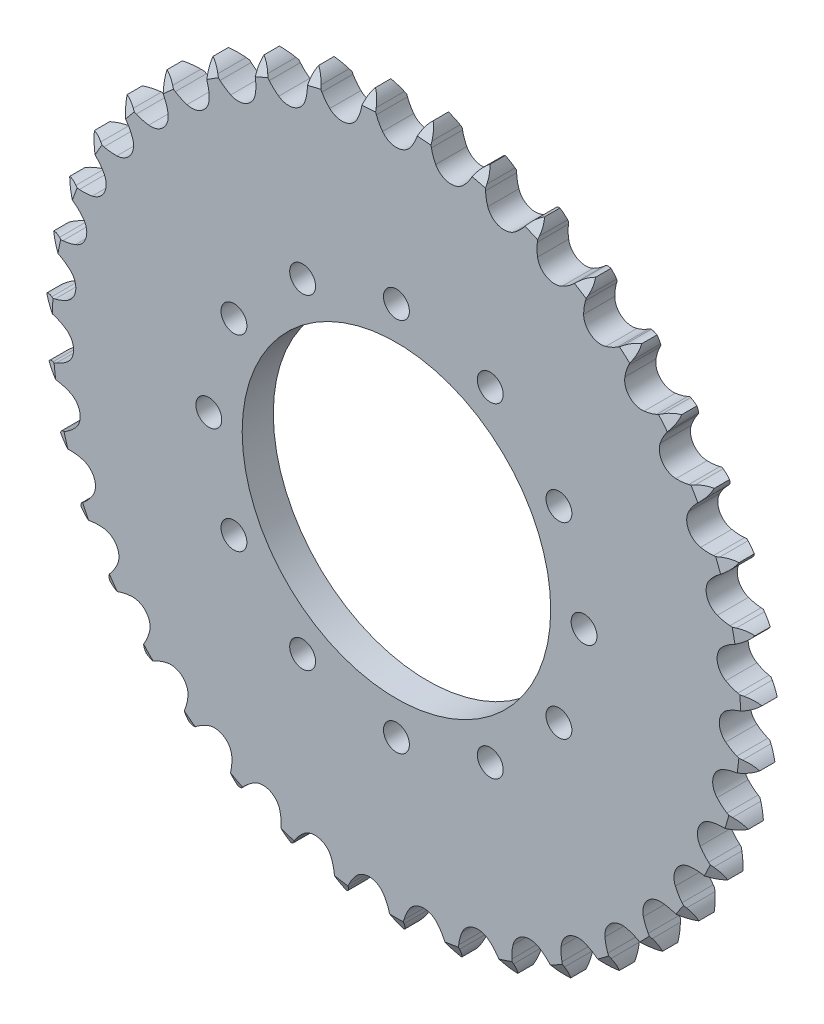
from build123d import *

# Parameters (mm, degrees)
EXTRUSION_DEPTH        = 7.2136
CUT_EXTRUDE_DEPTH      = 118.514389318
CUT_EXTRUDE_DEPTH_BACK = 118.514389318
SKETCH1_R              = 35.764294032
F_6_0MM_DOWEL_HOLE1_D  = 6
CIRPATTERN1_COUNT      = 12


with BuildPart() as part:
    # Teeth Sketch → Extrusion (new body)
    with BuildSketch(Plane.XY):
        with BuildLine():
            ThreePointArc((6.676484762, 82.703103732), (5.710873677, 81.555589606), (5.037571935, 80.215493266))
            Line((5.037571935, 80.215493266), (4.65053543, 79.150636707))
            ThreePointArc((4.65053543, 79.150636707), (4.030589042, 77.787636082), (3.22092759, 76.5280518))
            ThreePointArc((3.22092759, 76.5280518), (0, 74.905926143), (-3.22092759, 76.5280518))
            ThreePointArc((-3.22092759, 76.5280518), (-4.030589042, 77.787636082), (-4.65053543, 79.150636707))
            Line((-4.65053543, 79.150636707), (-5.037571935, 80.215493266))
            ThreePointArc((-5.037571935, 80.215493266), (-5.710873677, 81.555589606), (-6.676484762, 82.703103732))
            ThreePointArc((-6.676484762, 82.703103732), (-7.445517227, 81.415554702), (-7.895133318, 79.984807062))
            Line((-7.895133318, 79.984807062), (-8.106342797, 78.871655094))
            ThreePointArc((-8.106342797, 78.871655094), (-8.499620367, 77.426858575), (-9.096745387, 76.053706749))
            ThreePointArc((-9.096745387, 76.053706749), (-12.015755556, 73.935914073), (-15.455180235, 75.020360508))
            ThreePointArc((-15.455180235, 75.020360508), (-16.456408311, 76.133754674), (-17.286967233, 77.379658404))
            Line((-17.286967233, 77.379658404), (-17.83980672, 78.368640329))
            ThreePointArc((-17.83980672, 78.368640329), (-18.719355953, 79.583377579), (-19.856536839, 80.561136787))
            ThreePointArc((-19.856536839, 80.561136787), (-20.409073146, 79.166899696), (-20.623358765, 77.682556369))
            Line((-20.623358765, 77.682556369), (-20.653271004, 76.549939044))
            ThreePointArc((-20.653271004, 76.549939044), (-20.809694072, 75.060766102), (-21.178817437, 73.609610642))
            ThreePointArc((-21.178817437, 73.609610642), (-23.720309356, 71.051000665), (-27.289151829, 71.569681286))
            ThreePointArc((-27.289151829, 71.569681286), (-28.456015249, 72.508049011), (-29.475675664, 73.604587595))
            Line((-29.475675664, 73.604587595), (-30.179999883, 74.492080773))
            ThreePointArc((-30.179999883, 74.492080773), (-31.243016742, 75.549997876), (-32.522315041, 76.332678717))
            ThreePointArc((-32.522315041, 76.332678717), (-32.844044791, 74.867863573), (-32.817450053, 73.368368272))
            Line((-32.817450053, 73.368368272), (-32.66529034, 72.245619783))
            ThreePointArc((-32.66529034, 72.245619783), (-32.580807632, 70.750639215), (-32.71236924, 69.259064285))
            ThreePointArc((-32.71236924, 69.259064285), (-34.810519602, 66.325903661), (-38.416348726, 66.265384911))
            ThreePointArc((-38.416348726, 66.265384911), (-39.71862634, 67.004422965), (-40.900979579, 67.923196629))
            Line((-40.900979579, 67.923196629), (-41.738546902, 68.686215454))
            ThreePointArc((-41.738546902, 68.686215454), (-42.957499809, 69.559912912), (-44.345782367, 70.127244363))
            ThreePointArc((-44.345782367, 70.127244363), (-44.428372928, 68.629789109), (-44.161586623, 67.153977974))
            Line((-44.161586623, 67.153977974), (-43.831295815, 66.070176918))
            ThreePointArc((-43.831295815, 66.070176918), (-43.508095388, 64.608107935), (-43.398687863, 63.114744543))
            ThreePointArc((-43.398687863, 63.114744543), (-44.999155676, 59.883000591), (-48.54858237, 59.244849876))
            ThreePointArc((-48.54858237, 59.244849876), (-49.952545871, 59.765417561), (-51.266969607, 60.48263055))
            Line((-51.266969607, 60.48263055), (-52.21608748, 61.101413234))
            ThreePointArc((-52.21608748, 61.101413234), (-53.559406195, 61.768262742), (-55.020717224, 62.105551216))
            ThreePointArc((-55.020717224, 62.105551216), (-54.862029543, 60.614239157), (-54.361961296, 59.200334922))
            Line((-54.361961296, 59.200334922), (-53.862093752, 58.183551176))
            ThreePointArc((-53.862093752, 58.183551176), (-53.308546327, 56.792260597), (-52.961003266, 55.335786069))
            ThreePointArc((-52.961003266, 55.335786069), (-54.022337255, 51.889159262), (-57.423433231, 50.689904348))
            ThreePointArc((-57.423433231, 50.689904348), (-58.892720703, 50.978519235), (-60.305172051, 51.475596109))
            Line((-60.305172051, 51.475596109), (-61.34125882, 51.934116506))
            ThreePointArc((-61.34125882, 51.934116506), (-62.774152094, 52.376847013), (-64.270644405, 52.475356916))
            ThreePointArc((-64.270644405, 52.475356916), (-63.87478841, 51.02881225), (-63.154389727, 49.713434291))
            Line((-63.154389727, 49.713434291), (-62.497891753, 48.790002021))
            ThreePointArc((-62.497891753, 48.790002021), (-61.728333918, 47.505523541), (-61.151656504, 46.123659804))
            ThreePointArc((-61.151656504, 46.123659804), (-61.646368676, 42.551415963), (-64.811047336, 40.822116924))
            ThreePointArc((-64.811047336, 40.822116924), (-66.307605004, 40.871304038), (-67.781502216, 41.135370767))
            Line((-67.781502216, 41.135370767), (-68.877723777, 41.42175344))
            ThreePointArc((-68.877723777, 41.42175344), (-70.363080428, 41.628898458), (-71.855995657, 41.486078435))
            ThreePointArc((-71.855995657, 41.486078435), (-71.23322381, 40.12176591), (-70.311152637, 38.938981826))
            Line((-70.311152637, 38.938981826), (-69.515027187, 38.132817442))
            ThreePointArc((-69.515027187, 38.132817442), (-68.549390085, 36.988418379), (-67.75851396, 35.716954977))
            ThreePointArc((-67.75851396, 35.716954977), (-67.673791529, 32.111613343), (-70.520089358, 29.897058114))
            ThreePointArc((-70.520089358, 29.897058114), (-72.005157166, 29.705543536), (-73.502327078, 29.729760931))
            Line((-73.502327078, 29.729760931), (-74.630291869, 29.836588719))
            ThreePointArc((-74.630291869, 29.836588719), (-76.129641939, 29.8027833), (-77.580314364, 29.422332315))
            ThreePointArc((-77.580314364, 29.422332315), (-76.74675613, 28.175586908), (-75.646893627, 27.156030185))
            Line((-75.646893627, 27.156030185), (-74.731759931, 26.488012922))
            ThreePointArc((-74.731759931, 26.488012922), (-73.595053056, 25.51333261), (-72.610461496, 24.385199777))
            ThreePointArc((-72.610461496, 24.385199777), (-71.948498729, 20.840136804), (-74.402698108, 18.197681204))
            ThreePointArc((-74.402698108, 18.197681204), (-75.837813579, 17.77042506), (-77.319480277, 17.554165902))
            Line((-77.319480277, 17.554165902), (-78.449974603, 17.478672021))
            ThreePointArc((-78.449974603, 17.478672021), (-79.924485713, 17.204791709), (-81.295343681, 16.596563242))
            ThreePointArc((-81.295343681, 16.596563242), (-80.27258778, 15.499675005), (-79.023419807, 14.669751627))
            Line((-79.023419807, 14.669751627), (-78.012979347, 14.15718278))
            ThreePointArc((-78.012979347, 14.15718278), (-76.734642811, 13.377464928), (-75.58183622, 12.421880712))
            ThreePointArc((-75.58183622, 12.421880712), (-74.359777605, 9.028911669), (-76.358316059, 6.026993909))
            ThreePointArc((-76.358316059, 6.026993909), (-77.706310456, 5.375061909), (-79.134099551, 4.923927198))
            Line((-79.134099551, 4.923927198), (-80.237844202, 4.6680669))
            ThreePointArc((-80.237844202, 4.6680669), (-81.649327289, 4.161205049), (-82.904866299, 3.340951899))
            ThreePointArc((-82.904866299, 3.340951899), (-81.719401571, 2.422329661), (-80.353280924, 1.803534207))
            Line((-80.353280924, 1.803534207), (-79.273703577, 1.45968904))
            ThreePointArc((-79.273703577, 1.45968904), (-77.886845624, 0.895127931), (-76.595681088, 0.136841462))
            ThreePointArc((-76.595681088, 0.136841462), (-74.8451773, -3.016157536), (-76.336293733, -6.299789363))
            ThreePointArc((-76.336293733, -6.299789363), (-77.56225471, -7.159512522), (-78.899187214, -7.833838635))
            Line((-78.899187214, -7.833838635), (-79.947595784, -8.263438702))
            ThreePointArc((-79.947595784, -8.263438702), (-81.259494176, -8.990154635), (-82.367196428, -10.001188343))
            ThreePointArc((-82.367196428, -10.001188343), (-81.049725787, -10.717752749), (-79.602034272, -11.109393802))
            Line((-79.602034272, -11.109393802), (-78.481280524, -11.275609878))
            ThreePointArc((-78.481280524, -11.275609878), (-77.021820047, -11.610392409), (-75.625738049, -12.151741911))
            ThreePointArc((-75.625738049, -12.151741911), (-73.392126218, -14.983109845), (-74.337201497, -18.463411399))
            ThreePointArc((-74.337201497, -18.463411399), (-75.409377308, -19.50865934), (-76.620827372, -20.388712162))
            Line((-76.620827372, -20.388712162), (-77.586746629, -20.980925582))
            ThreePointArc((-77.586746629, -20.980925582), (-78.765082849, -21.908674036), (-79.696259435, -23.08430306))
            ThreePointArc((-79.696259435, -23.08430306), (-78.280904679, -23.580250992), (-76.789136745, -23.734594346))
            Line((-76.789136745, -23.734594346), (-75.656233531, -23.718876424))
            ThreePointArc((-75.656233531, -23.718876424), (-74.161969788, -23.815209685), (-72.697128119, -24.125601551))
            ThreePointArc((-72.697128119, -24.125601551), (-70.038257617, -26.562007479), (-70.41281479, -30.148840778))
            ThreePointArc((-70.41281479, -30.148840778), (-71.303436645, -31.352542128), (-72.358028349, -32.415528753))
            Line((-72.358028349, -32.415528753), (-73.216441492, -33.155017511))
            ThreePointArc((-73.216441492, -33.155017511), (-74.230697248, -34.259770288), (-74.961231185, -35.569546454))
            ThreePointArc((-74.961231185, -35.569546454), (-73.484649258, -35.832033121), (-71.987440912, -35.745081364))
            Line((-71.987440912, -35.745081364), (-70.871729829, -35.547836529))
            ThreePointArc((-70.871729829, -35.547836529), (-69.381363468, -35.403225539), (-67.885700756, -35.474620783))
            ThreePointArc((-67.885700756, -35.474620783), (-64.870434934, -37.452963072), (-64.664773166, -41.053431017))
            ThreePointArc((-64.664773166, -41.053431017), (-65.350774426, -42.384410543), (-66.221194398, -43.602800177))
            Line((-66.221194398, -43.602800177), (-66.949868978, -44.470411902))
            ThreePointArc((-66.949868978, -44.470411902), (-67.773775581, -45.723556485), (-68.284746423, -47.133557278))
            ThreePointArc((-68.284746423, -47.133557278), (-66.785180021, -47.155784414), (-65.321308173, -46.829789551))
            Line((-65.321308173, -46.829789551), (-64.251685552, -46.456126341))
            ThreePointArc((-64.251685552, -46.456126341), (-62.803816278, -46.074316448), (-61.316069403, -45.904865971))
            ThreePointArc((-61.316069403, -45.904865971), (-58.022502061, -47.373906594), (-57.241947884, -50.894758957))
            ThreePointArc((-57.241947884, -50.894758957), (-57.705561477, -52.318544989), (-58.369266298, -53.66078198))
            Line((-58.369266298, -53.66078198), (-58.949330025, -54.634045983))
            ThreePointArc((-58.949330025, -54.634045983), (-59.561548726, -56.003126587), (-59.839722596, -57.476833727))
            ThreePointArc((-59.839722596, -57.476833727), (-58.356009703, -57.25822566), (-56.963387864, -56.701630787))
            Line((-56.963387864, -56.701630787), (-55.967556369, -56.161226883))
            ThreePointArc((-55.967556369, -56.161226883), (-54.599683236, -55.552106762), (-53.15838406, -55.146199243))
            ThreePointArc((-53.15838406, -55.146199243), (-49.671816862, -56.06789082), (-48.336586219, -59.417939375))
            ThreePointArc((-48.336586219, -59.417939375), (-48.565804798, -60.897656602), (-49.00560486, -62.328977716))
            Line((-49.00560486, -62.328977716), (-49.422034389, -63.382686971))
            ThreePointArc((-49.422034389, -63.382686971), (-49.806709045, -64.832245127), (-49.844881387, -66.331490374))
            ThreePointArc((-49.844881387, -66.331490374), (-48.415449386, -65.877708938), (-47.130145731, -65.104929569))
            Line((-47.130145731, -65.104929569), (-46.233896874, -64.411781148))
            ThreePointArc((-46.233896874, -64.411781148), (-44.981447078, -63.591126692), (-43.623924493, -62.959274922))
            ThreePointArc((-43.623924493, -62.959274922), (-40.034657698, -63.309746125), (-38.179332362, -66.402226373))
            ThreePointArc((-38.179332362, -66.402226373), (-38.168219284, -67.899550896), (-38.372723998, -69.38288567))
            Line((-38.372723998, -69.38288567), (-38.614734022, -70.489749661))
            ThreePointArc((-38.614734022, -70.489749661), (-38.761901763, -71.982242573), (-38.559083932, -73.468196262))
            ThreePointArc((-38.559083932, -73.468196262), (-37.220954361, -72.790994159), (-36.076257579, -71.822044874))
            Line((-36.076257579, -71.822044874), (-35.302803736, -70.994104116))
            ThreePointArc((-35.302803736, -70.994104116), (-34.198215068, -69.983169844), (-32.959628196, -69.141738451))
            ThreePointArc((-32.959628196, -69.141738451), (-29.360621929, -68.91191226), (-27.033253851, -71.666730588))
            ThreePointArc((-27.033253851, -71.666730588), (-26.78209694, -73.142882488), (-26.74600974, -74.639813329))
            Line((-26.74600974, -74.639813329), (-26.807332328, -75.77116486))
            ThreePointArc((-26.807332328, -75.77116486), (-26.713181585, -77.267937748), (-26.274626458, -78.702114459))
            ThreePointArc((-26.274626458, -78.702114459), (-25.06245617, -77.819030866), (-24.088013307, -76.679006943))
            Line((-24.088013307, -76.679006943), (-23.457386525, -75.737717079))
            ThreePointArc((-23.457386525, -75.737717079), (-22.529267252, -74.562685657), (-21.441694841, -73.533467273))
            ThreePointArc((-21.441694841, -73.533467273), (-17.926161474, -72.729296065), (-15.187028265, -75.075104125))
            ThreePointArc((-15.187028265, -75.075104125), (-14.702332353, -76.491851845), (-14.426587879, -77.96360903))
            Line((-14.426587879, -77.96360903), (-14.305634807, -79.090146691))
            ThreePointArc((-14.305634807, -79.090146691), (-13.972604036, -80.552433921), (-13.309669959, -81.897689231))
            ThreePointArc((-13.309669959, -81.897689231), (-12.254853529, -80.83159555), (-11.475902142, -79.55002301))
            Line((-11.475902142, -79.55002301), (-11.004435324, -78.519762952))
            ThreePointArc((-11.004435324, -78.519762952), (-10.276823247, -77.211067077), (-9.368432854, -76.020717918))
            ThreePointArc((-9.368432854, -76.020717918), (-6.027422853, -74.663029306), (-2.947466624, -76.5390719))
            ThreePointArc((-2.947466624, -76.5390719), (-2.241785081, -77.859722417), (-1.733524971, -79.26818821))
            Line((-1.733524971, -79.26818821), (-1.43342886, -80.360735266))
            ThreePointArc((-1.43342886, -80.360735266), (-0.870143382, -81.750664368), (0, -82.97215687))
            ThreePointArc((0, -82.97215687), (0.870143382, -81.750664368), (1.43342886, -80.360735266))
            Line((1.43342886, -80.360735266), (1.733524971, -79.26818821))
            ThreePointArc((1.733524971, -79.26818821), (2.241785081, -77.859722417), (2.947466624, -76.5390719))
            ThreePointArc((2.947466624, -76.5390719), (6.027422853, -74.663029306), (9.368432854, -76.020717918))
            ThreePointArc((9.368432854, -76.020717918), (10.276823247, -77.211067077), (11.004435324, -78.519762952))
            Line((11.004435324, -78.519762952), (11.475902142, -79.55002301))
            ThreePointArc((11.475902142, -79.55002301), (12.254853529, -80.83159555), (13.309669959, -81.897689231))
            ThreePointArc((13.309669959, -81.897689231), (13.972604036, -80.552433921), (14.305634807, -79.090146691))
            Line((14.305634807, -79.090146691), (14.426587879, -77.96360903))
            ThreePointArc((14.426587879, -77.96360903), (14.702332353, -76.491851845), (15.187028265, -75.075104125))
            ThreePointArc((15.187028265, -75.075104125), (17.926161474, -72.729296065), (21.441694841, -73.533467273))
            ThreePointArc((21.441694841, -73.533467273), (22.529267252, -74.562685657), (23.457386525, -75.737717079))
            Line((23.457386525, -75.737717079), (24.088013307, -76.679006943))
            ThreePointArc((24.088013307, -76.679006943), (25.06245617, -77.819030866), (26.274626458, -78.702114459))
            ThreePointArc((26.274626458, -78.702114459), (26.713181585, -77.267937748), (26.807332328, -75.77116486))
            Line((26.807332328, -75.77116486), (26.74600974, -74.639813329))
            ThreePointArc((26.74600974, -74.639813329), (26.78209694, -73.142882488), (27.033253851, -71.666730588))
            ThreePointArc((27.033253851, -71.666730588), (29.360621929, -68.91191226), (32.959628196, -69.141738451))
            ThreePointArc((32.959628196, -69.141738451), (34.198215068, -69.983169844), (35.302803736, -70.994104116))
            Line((35.302803736, -70.994104116), (36.076257579, -71.822044874))
            ThreePointArc((36.076257579, -71.822044874), (37.220954361, -72.790994159), (38.559083932, -73.468196262))
            ThreePointArc((38.559083932, -73.468196262), (38.761901763, -71.982242573), (38.614734022, -70.489749661))
            Line((38.614734022, -70.489749661), (38.372723998, -69.38288567))
            ThreePointArc((38.372723998, -69.38288567), (38.168219284, -67.899550896), (38.179332362, -66.402226373))
            ThreePointArc((38.179332362, -66.402226373), (40.034657698, -63.309746125), (43.623924493, -62.959274922))
            ThreePointArc((43.623924493, -62.959274922), (44.981447078, -63.591126692), (46.233896874, -64.411781148))
            Line((46.233896874, -64.411781148), (47.130145731, -65.104929569))
            ThreePointArc((47.130145731, -65.104929569), (48.415449386, -65.877708938), (49.844881387, -66.331490374))
            ThreePointArc((49.844881387, -66.331490374), (49.806709045, -64.832245127), (49.422034389, -63.382686971))
            Line((49.422034389, -63.382686971), (49.00560486, -62.328977716))
            ThreePointArc((49.00560486, -62.328977716), (48.565804798, -60.897656602), (48.336586219, -59.417939375))
            ThreePointArc((48.336586219, -59.417939375), (49.671816862, -56.06789082), (53.15838406, -55.146199243))
            ThreePointArc((53.15838406, -55.146199243), (54.599683236, -55.552106762), (55.967556369, -56.161226883))
            Line((55.967556369, -56.161226883), (56.963387864, -56.701630787))
            ThreePointArc((56.963387864, -56.701630787), (58.356009703, -57.25822566), (59.839722596, -57.476833727))
            ThreePointArc((59.839722596, -57.476833727), (59.561548726, -56.003126587), (58.949330025, -54.634045983))
            Line((58.949330025, -54.634045983), (58.369266298, -53.66078198))
            ThreePointArc((58.369266298, -53.66078198), (57.705561477, -52.318544989), (57.241947884, -50.894758957))
            ThreePointArc((57.241947884, -50.894758957), (58.022502061, -47.373906594), (61.316069403, -45.904865971))
            ThreePointArc((61.316069403, -45.904865971), (62.803816278, -46.074316448), (64.251685552, -46.456126341))
            Line((64.251685552, -46.456126341), (65.321308173, -46.829789551))
            ThreePointArc((65.321308173, -46.829789551), (66.785180021, -47.155784414), (68.284746423, -47.133557278))
            ThreePointArc((68.284746423, -47.133557278), (67.773775581, -45.723556485), (66.949868978, -44.470411902))
            Line((66.949868978, -44.470411902), (66.221194398, -43.602800177))
            ThreePointArc((66.221194398, -43.602800177), (65.350774426, -42.384410543), (64.664773166, -41.053431017))
            ThreePointArc((64.664773166, -41.053431017), (64.870434934, -37.452963072), (67.885700756, -35.474620783))
            ThreePointArc((67.885700756, -35.474620783), (69.381363468, -35.403225539), (70.871729829, -35.547836529))
            Line((70.871729829, -35.547836529), (71.987440912, -35.745081364))
            ThreePointArc((71.987440912, -35.745081364), (73.484649258, -35.832033121), (74.961231185, -35.569546454))
            ThreePointArc((74.961231185, -35.569546454), (74.230697248, -34.259770288), (73.216441492, -33.155017511))
            Line((73.216441492, -33.155017511), (72.358028349, -32.415528753))
            ThreePointArc((72.358028349, -32.415528753), (71.303436645, -31.352542128), (70.41281479, -30.148840778))
            ThreePointArc((70.41281479, -30.148840778), (70.038257617, -26.562007479), (72.697128119, -24.125601551))
            ThreePointArc((72.697128119, -24.125601551), (74.161969788, -23.815209685), (75.656233531, -23.718876424))
            Line((75.656233531, -23.718876424), (76.789136745, -23.734594346))
            ThreePointArc((76.789136745, -23.734594346), (78.280904679, -23.580250992), (79.696259435, -23.08430306))
            ThreePointArc((79.696259435, -23.08430306), (78.765082849, -21.908674036), (77.586746629, -20.980925582))
            Line((77.586746629, -20.980925582), (76.620827372, -20.388712162))
            ThreePointArc((76.620827372, -20.388712162), (75.409377308, -19.50865934), (74.337201497, -18.463411399))
            ThreePointArc((74.337201497, -18.463411399), (73.392126218, -14.983109845), (75.625738049, -12.151741911))
            ThreePointArc((75.625738049, -12.151741911), (77.021820047, -11.610392409), (78.481280524, -11.275609878))
            Line((78.481280524, -11.275609878), (79.602034272, -11.109393802))
            ThreePointArc((79.602034272, -11.109393802), (81.049725787, -10.717752749), (82.367196428, -10.001188343))
            ThreePointArc((82.367196428, -10.001188343), (81.259494176, -8.990154635), (79.947595784, -8.263438702))
            Line((79.947595784, -8.263438702), (78.899187214, -7.833838635))
            ThreePointArc((78.899187214, -7.833838635), (77.56225471, -7.159512522), (76.336293733, -6.299789363))
            ThreePointArc((76.336293733, -6.299789363), (74.8451773, -3.016157536), (76.595681088, 0.136841462))
            ThreePointArc((76.595681088, 0.136841462), (77.886845624, 0.895127931), (79.273703577, 1.45968904))
            Line((79.273703577, 1.45968904), (80.353280924, 1.803534207))
            ThreePointArc((80.353280924, 1.803534207), (81.719401571, 2.422329661), (82.904866299, 3.340951899))
            ThreePointArc((82.904866299, 3.340951899), (81.649327289, 4.161205049), (80.237844202, 4.6680669))
            Line((80.237844202, 4.6680669), (79.134099551, 4.923927198))
            ThreePointArc((79.134099551, 4.923927198), (77.706310456, 5.375061909), (76.358316059, 6.026993909))
            ThreePointArc((76.358316059, 6.026993909), (74.359777605, 9.028911669), (75.58183622, 12.421880712))
            ThreePointArc((75.58183622, 12.421880712), (76.734642811, 13.377464928), (78.012979347, 14.15718278))
            Line((78.012979347, 14.15718278), (79.023419807, 14.669751627))
            ThreePointArc((79.023419807, 14.669751627), (80.27258778, 15.499675005), (81.295343681, 16.596563242))
            ThreePointArc((81.295343681, 16.596563242), (79.924485713, 17.204791709), (78.449974603, 17.478672021))
            Line((78.449974603, 17.478672021), (77.319480277, 17.554165902))
            ThreePointArc((77.319480277, 17.554165902), (75.837813579, 17.77042506), (74.402698108, 18.197681204))
            ThreePointArc((74.402698108, 18.197681204), (71.948498729, 20.840136804), (72.610461496, 24.385199777))
            ThreePointArc((72.610461496, 24.385199777), (73.595053056, 25.51333261), (74.731759931, 26.488012922))
            Line((74.731759931, 26.488012922), (75.646893627, 27.156030185))
            ThreePointArc((75.646893627, 27.156030185), (76.74675613, 28.175586908), (77.580314364, 29.422332315))
            ThreePointArc((77.580314364, 29.422332315), (76.129641939, 29.8027833), (74.630291869, 29.836588719))
            Line((74.630291869, 29.836588719), (73.502327078, 29.729760931))
            ThreePointArc((73.502327078, 29.729760931), (72.005157166, 29.705543536), (70.520089358, 29.897058114))
            ThreePointArc((70.520089358, 29.897058114), (67.673791529, 32.111613343), (67.75851396, 35.716954977))
            ThreePointArc((67.75851396, 35.716954977), (68.549390085, 36.988418379), (69.515027187, 38.132817442))
            Line((69.515027187, 38.132817442), (70.311152637, 38.938981826))
            ThreePointArc((70.311152637, 38.938981826), (71.23322381, 40.12176591), (71.855995657, 41.486078435))
            ThreePointArc((71.855995657, 41.486078435), (70.363080428, 41.628898458), (68.877723777, 41.42175344))
            Line((68.877723777, 41.42175344), (67.781502216, 41.135370767))
            ThreePointArc((67.781502216, 41.135370767), (66.307605004, 40.871304038), (64.811047336, 40.822116924))
            ThreePointArc((64.811047336, 40.822116924), (61.646368676, 42.551415963), (61.151656504, 46.123659804))
            ThreePointArc((61.151656504, 46.123659804), (61.728333918, 47.505523541), (62.497891753, 48.790002021))
            Line((62.497891753, 48.790002021), (63.154389727, 49.713434291))
            ThreePointArc((63.154389727, 49.713434291), (63.87478841, 51.02881225), (64.270644405, 52.475356916))
            ThreePointArc((64.270644405, 52.475356916), (62.774152094, 52.376847013), (61.34125882, 51.934116506))
            Line((61.34125882, 51.934116506), (60.305172051, 51.475596109))
            ThreePointArc((60.305172051, 51.475596109), (58.892720703, 50.978519235), (57.423433231, 50.689904348))
            ThreePointArc((57.423433231, 50.689904348), (54.022337255, 51.889159262), (52.961003266, 55.335786069))
            ThreePointArc((52.961003266, 55.335786069), (53.308546327, 56.792260597), (53.862093752, 58.183551176))
            Line((53.862093752, 58.183551176), (54.361961296, 59.200334922))
            ThreePointArc((54.361961296, 59.200334922), (54.862029543, 60.614239157), (55.020717224, 62.105551216))
            ThreePointArc((55.020717224, 62.105551216), (53.559406195, 61.768262742), (52.21608748, 61.101413234))
            Line((52.21608748, 61.101413234), (51.266969607, 60.48263055))
            ThreePointArc((51.266969607, 60.48263055), (49.952545871, 59.765417561), (48.54858237, 59.244849876))
            ThreePointArc((48.54858237, 59.244849876), (44.999155676, 59.883000591), (43.398687863, 63.114744543))
            ThreePointArc((43.398687863, 63.114744543), (43.508095388, 64.608107935), (43.831295815, 66.070176918))
            Line((43.831295815, 66.070176918), (44.161586623, 67.153977974))
            ThreePointArc((44.161586623, 67.153977974), (44.428372928, 68.629789109), (44.345782367, 70.127244363))
            ThreePointArc((44.345782367, 70.127244363), (42.957499809, 69.559912912), (41.738546902, 68.686215454))
            Line((41.738546902, 68.686215454), (40.900979579, 67.923196629))
            ThreePointArc((40.900979579, 67.923196629), (39.71862634, 67.004422965), (38.416348726, 66.265384911))
            ThreePointArc((38.416348726, 66.265384911), (34.810519602, 66.325903661), (32.71236924, 69.259064285))
            ThreePointArc((32.71236924, 69.259064285), (32.580807632, 70.750639215), (32.66529034, 72.245619783))
            Line((32.66529034, 72.245619783), (32.817450053, 73.368368272))
            ThreePointArc((32.817450053, 73.368368272), (32.844044791, 74.867863573), (32.522315041, 76.332678717))
            ThreePointArc((32.522315041, 76.332678717), (31.243016742, 75.549997876), (30.179999883, 74.492080773))
            Line((30.179999883, 74.492080773), (29.475675664, 73.604587595))
            ThreePointArc((29.475675664, 73.604587595), (28.456015249, 72.508049011), (27.289151829, 71.569681286))
            ThreePointArc((27.289151829, 71.569681286), (23.720309356, 71.051000665), (21.178817437, 73.609610642))
            ThreePointArc((21.178817437, 73.609610642), (20.809694072, 75.060766102), (20.653271004, 76.549939044))
            Line((20.653271004, 76.549939044), (20.623358765, 77.682556369))
            ThreePointArc((20.623358765, 77.682556369), (20.409073146, 79.166899696), (19.856536839, 80.561136787))
            ThreePointArc((19.856536839, 80.561136787), (18.719355953, 79.583377579), (17.83980672, 78.368640329))
            Line((17.83980672, 78.368640329), (17.286967233, 77.379658404))
            ThreePointArc((17.286967233, 77.379658404), (16.456408311, 76.133754674), (15.455180235, 75.020360508))
            ThreePointArc((15.455180235, 75.020360508), (12.015755556, 73.935914073), (9.096745387, 76.053706749))
            ThreePointArc((9.096745387, 76.053706749), (8.499620367, 77.426858575), (8.106342797, 78.871655094))
            Line((8.106342797, 78.871655094), (7.895133318, 79.984807062))
            ThreePointArc((7.895133318, 79.984807062), (7.445517227, 81.415554702), (6.676484762, 82.703103732))
        make_face()
    extrude(amount=EXTRUSION_DEPTH)

    # Sketch1 → Cut-Extrude (cut, two sides: drawn at the far end of the back side and taken through both)
    with BuildSketch(Plane(origin=(0, 0, 0), x_dir=(-1, 0, 0), z_dir=(0, 0, -1)).offset(-CUT_EXTRUDE_DEPTH_BACK)):
        Circle(SKETCH1_R)
    extrude(amount=CUT_EXTRUDE_DEPTH + CUT_EXTRUDE_DEPTH_BACK, mode=Mode.SUBTRACT)

    # Ø6.0mm Dowel Hole1 (through all)
    with Locations(Plane.XY.offset(7.2136)):
        with Locations((-43.500000122, 0)):
            f_6_0mm_dowel_hole1 = Hole(F_6_0MM_DOWEL_HOLE1_D / 2)

    # CirPattern1: Ø6.0mm Dowel Hole1 ×12 about axis
    cirpattern1_axis = Axis((0, 0, 7.2136), (0, 0, -1))
    for i in range(1, CIRPATTERN1_COUNT):
        add(f_6_0mm_dowel_hole1.rotate(cirpattern1_axis, i * 360 / CIRPATTERN1_COUNT), mode=Mode.SUBTRACT)

    # Sketch5 → Cut-Revolve1 (revolve, cut)
    with BuildSketch(Plane(origin=(0, 0, 0), x_dir=(0, 0, -1), z_dir=(1, 0, 0))):
        Polygon((-5.3848, -82.97215687), (-7.2136, -79.778574738), (-7.2136, -82.97215687), align=None)
    cut_revolve1 = revolve(axis=Axis((0, 0, 7.2136), (0, 0, -1)), mode=Mode.SUBTRACT)

    # Mirror1: Cut-Revolve1 across plane
    add(cut_revolve1.mirror(Plane.XY.offset(3.6068)), mode=Mode.SUBTRACT)


solid = part.part
